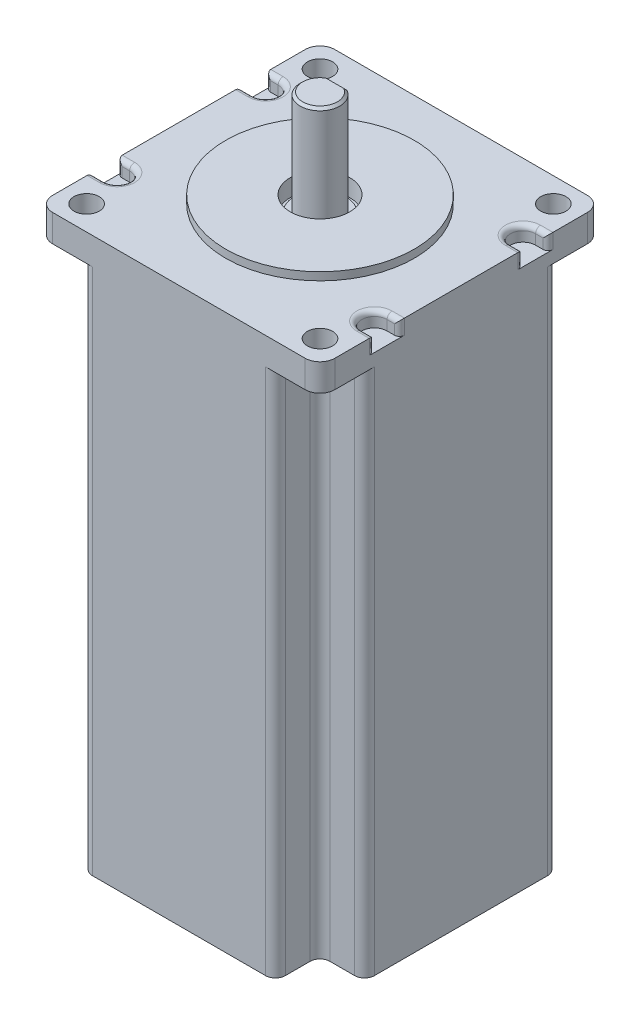
from build123d import *

# Parameters (mm, degrees)
SKETCH1_W                         = 57
SKETCH1_H                         = 57
MOTOR_RECTANGULAR_FRAME_DEPTH     = 112
MOTOR_SCREW_HOLE_LENGTHS_DEPTH    = 106.5
SKETCH3_R                         = 2.55
MOTOR_MOUNT_HOLES_DEPTH           = 114.87163826
SKETCH4_R                         = 6
REAR_BEARING_AND_SHAFT_DEPTH      = 4.5
SKETCH5_R                         = 6
SKETCH5_R_2                       = 4.5
REAR_BEARING_SHIELD_DEPTH         = 0.5
SKETCH6_R                         = 8
HOLLOWED_SECTION_REAR_DEPTH       = 3
SKETCH7_R                         = 19.05
FRONT_PLATFORM_EXTRUDE_DEPTH      = 1.6
FRONT_START                       = -3
SKETCH8_R                         = 6
FRONT_BEARING_DEPTH               = 3
FRONT_SHAFT_DEPTH                 = 21
FRONT_START_2                     = -0.5
SKETCH10_R                        = 6
SKETCH10_R_2                      = 5.25
FRONT_BEARING_SHEILD_DEPTH        = 0.5
MOTOR_SHAFT_CHAMFER_SIZE          = 0.5
MOTOR_FRONT_EDGE_FILLET_R         = 3
FRONT_COVER_SCREW_INDENTS_DEPTH   = 3
FRONT_COVER_SCREW_INDENT_FILLET_R = 1
SKETCH12_W                        = 7
SKETCH12_H                        = 5
SKETCH12_W_2                      = 5
SKETCH12_H_2                      = 4
WIRE_AREA_DEPTH                   = 3


with BuildPart() as part:
    # Sketch1 → Motor rectangular frame (new body)
    with BuildSketch(Plane(origin=(0, 0, 0), x_dir=(1, 0, 0), z_dir=(0, 1, 0))):
        Rectangle(SKETCH1_W, SKETCH1_H)
    extrude(amount=MOTOR_RECTANGULAR_FRAME_DEPTH)

    # Sketch2 → Motor screw hole lengths (cut)
    with BuildSketch(Plane.XZ):
        with BuildLine():
            Line((-26.5, 19.5), (-21.5, 19.5))
            ThreePointArc((-21.5, 19.5), (-20.085786438, 20.085786438), (-19.5, 21.5))
            Line((-19.5, 21.5), (-19.5, 26.5))
            ThreePointArc((-19.5, 26.5), (-18.914213562, 27.914213562), (-17.5, 28.5))
            Line((-17.5, 28.5), (-28.5, 28.5))
            Line((-28.5, 28.5), (-28.5, 17.5))
            ThreePointArc((-28.5, 17.5), (-27.914213562, 18.914213562), (-26.5, 19.5))
        make_face()
        with BuildLine():
            Line((19.5, 26.5), (19.5, 21.5))
            ThreePointArc((19.5, 21.5), (20.085786438, 20.085786438), (21.5, 19.5))
            Line((21.5, 19.5), (26.5, 19.5))
            ThreePointArc((26.5, 19.5), (27.914213562, 18.914213562), (28.5, 17.5))
            Line((28.5, 17.5), (28.5, 28.5))
            Line((28.5, 28.5), (17.5, 28.5))
            ThreePointArc((17.5, 28.5), (18.914213562, 27.914213562), (19.5, 26.5))
        make_face()
        with BuildLine():
            Line((26.5, -19.5), (21.5, -19.5))
            ThreePointArc((21.5, -19.5), (20.085786438, -20.085786438), (19.5, -21.5))
            Line((19.5, -21.5), (19.5, -26.5))
            ThreePointArc((19.5, -26.5), (18.914213562, -27.914213562), (17.5, -28.5))
            Line((17.5, -28.5), (28.5, -28.5))
            Line((28.5, -28.5), (28.5, -17.5))
            ThreePointArc((28.5, -17.5), (27.914213562, -18.914213562), (26.5, -19.5))
        make_face()
        with BuildLine():
            Line((-19.5, -26.5), (-19.5, -21.5))
            ThreePointArc((-19.5, -21.5), (-20.085786438, -20.085786438), (-21.5, -19.5))
            Line((-21.5, -19.5), (-26.5, -19.5))
            ThreePointArc((-26.5, -19.5), (-27.914213562, -18.914213562), (-28.5, -17.5))
            Line((-28.5, -17.5), (-28.5, -28.5))
            Line((-28.5, -28.5), (-17.5, -28.5))
            ThreePointArc((-17.5, -28.5), (-18.914213562, -27.914213562), (-19.5, -26.5))
        make_face()
    extrude(amount=-MOTOR_SCREW_HOLE_LENGTHS_DEPTH, mode=Mode.SUBTRACT)

    # Sketch3 → Motor mount holes (cut, through all)
    with BuildSketch(Plane.XZ.offset(-106.5)):
        with Locations(Location((-23.57, 23.57, 0), (0, 0, 270))):
            Circle(SKETCH3_R)
        with Locations(Location((23.57, 23.57, 0), (0, 0, 270))):
            Circle(SKETCH3_R)
        with Locations(Location((23.57, -23.57, 0), (0, 0, 90))):
            Circle(SKETCH3_R)
        with Locations(Location((-23.57, -23.57, 0), (0, 0, 90))):
            Circle(SKETCH3_R)
    extrude(amount=-MOTOR_MOUNT_HOLES_DEPTH, mode=Mode.SUBTRACT)

    # Sketch4 → Rear bearing and shaft (cut)
    with BuildSketch(Plane.XZ):
        with Locations(Location((0, 0, 0), (0, 0, 270))):
            Circle(SKETCH4_R)
    extrude(amount=-REAR_BEARING_AND_SHAFT_DEPTH, mode=Mode.SUBTRACT)

    # Sketch5 → Rear bearing shield (cut)
    with BuildSketch(Plane.XZ.offset(-4.5)):
        with Locations(Location((0, 0, 0), (0, 0, 270))):
            Circle(SKETCH5_R)
        with Locations(Location((0, 0, 0), (0, 0, 270))):
            Circle(SKETCH5_R_2, mode=Mode.SUBTRACT)
    extrude(amount=-REAR_BEARING_SHIELD_DEPTH, mode=Mode.SUBTRACT)

    # Sketch6 → Hollowed section (rear) (cut)
    with BuildSketch(Plane.XZ.offset(-4.5)):
        with Locations(Location((0, 0, 0), (0, 0, 270))):
            Circle(SKETCH6_R)
    extrude(amount=HOLLOWED_SECTION_REAR_DEPTH, mode=Mode.SUBTRACT)

    # Sketch7 → Front platform extrude (add)
    with BuildSketch(Plane(origin=(0, 112, 0), x_dir=(1, 0, 0), z_dir=(0, 1, 0))):
        with Locations(Location((0, 0, 0), (0, 0, 270))):
            Circle(SKETCH7_R)
    extrude(amount=FRONT_PLATFORM_EXTRUDE_DEPTH)

    # Sketch8 → Front bearing (cut)
    with BuildSketch(Plane(origin=(0, 113.6, 0), x_dir=(1, 0, 0), z_dir=(0, 1, 0)).offset(FRONT_START)):
        with Locations(Location((0, 0, 0), (0, 0, 90))):
            Circle(SKETCH8_R)
    extrude(amount=FRONT_BEARING_DEPTH, mode=Mode.SUBTRACT)

    # Sketch9 → Front shaft (add)
    with BuildSketch(Plane(origin=(0, 110.6, 0), x_dir=(1, 0, 0), z_dir=(0, 1, 0))):
        with BuildLine():
            Line((-1.936491673, 3.5), (1.936491673, 3.5))
            ThreePointArc((1.936491673, 3.5), (0, -4), (-1.936491673, 3.5))
        make_face()
    extrude(amount=FRONT_SHAFT_DEPTH)

    # Sketch10 → Front bearing sheild (cut)
    with BuildSketch(Plane(origin=(0, 110.6, 0), x_dir=(1, 0, 0), z_dir=(0, 1, 0)).offset(FRONT_START_2)):
        with Locations(Location((0, 0, 0), (0, 0, 90))):
            Circle(SKETCH10_R)
        with Locations(Location((0, 0, 0), (0, 0, 270))):
            Circle(SKETCH10_R_2, mode=Mode.SUBTRACT)
    extrude(amount=FRONT_BEARING_SHEILD_DEPTH, mode=Mode.SUBTRACT)

    # Motor shaft chamfer
    motor_shaft_chamfer_edges = [part.edges().sort_by_distance(p)[0] for p in [
        (0, 131.6, 4),
        (0, 131.6, -3.5),
    ]]
    chamfer(motor_shaft_chamfer_edges, length=MOTOR_SHAFT_CHAMFER_SIZE - 0.0001)  # a hair under: the kernel refuses the full size

    # Motor front edge fillet
    motor_front_edge_fillet_edges = [part.edges().sort_by_distance(p)[0] for p in [
        (28.5, 109.25, 28.5),
        (-28.5, 109.25, 28.5),
        (-28.5, 109.25, -28.5),
        (28.5, 109.25, -28.5),
    ]]
    fillet(motor_front_edge_fillet_edges, radius=MOTOR_FRONT_EDGE_FILLET_R)

    # Sketch11 → Front cover screw indents (cut)
    with BuildSketch(Plane(origin=(0, 112, 0), x_dir=(1, 0, 0), z_dir=(0, 1, 0))):
        with BuildLine():
            Line((26, 17.55), (28.5, 17.55))
            Line((28.5, 17.55), (28.5, 12.45))
            Line((28.5, 12.45), (26, 12.45))
            ThreePointArc((26, 12.45), (23.45, 15), (26, 17.55))
        make_face()
        with BuildLine():
            Line((26, -12.45), (28.5, -12.45))
            Line((28.5, -12.45), (28.5, -17.55))
            Line((28.5, -17.55), (26, -17.55))
            ThreePointArc((26, -17.55), (23.45, -15), (26, -12.45))
        make_face()
        with BuildLine():
            Line((-26, -12.45), (-28.5, -12.45))
            Line((-28.5, -12.45), (-28.5, -17.55))
            Line((-28.5, -17.55), (-26, -17.55))
            ThreePointArc((-26, -17.55), (-23.45, -15), (-26, -12.45))
        make_face()
        with BuildLine():
            Line((-26, 17.55), (-28.5, 17.55))
            Line((-28.5, 17.55), (-28.5, 12.45))
            Line((-28.5, 12.45), (-26, 12.45))
            ThreePointArc((-26, 12.45), (-23.45, 15), (-26, 17.55))
        make_face()
    extrude(amount=-FRONT_COVER_SCREW_INDENTS_DEPTH, mode=Mode.SUBTRACT)

    # Front cover screw indent fillet
    front_cover_screw_indent_fillet_edges = [part.edges().sort_by_distance(p)[0] for p in [
        (-28.5, 110.5, -12.45),
        (-28.5, 110.5, -17.55),
        (-23.45, 112, -15),
        (-27.25, 112, -17.55),
        (-27.25, 112, -12.45),
        (-28.5, 110.5, 17.55),
        (-28.5, 110.5, 12.45),
        (-23.45, 112, 15),
        (-27.25, 112, 12.45),
        (-27.25, 112, 17.55),
        (28.5, 110.5, 12.45),
        (28.5, 110.5, 17.55),
        (23.45, 112, 15),
        (27.25, 112, 17.55),
        (27.25, 112, 12.45),
        (28.5, 110.5, -17.55),
        (28.5, 110.5, -12.45),
        (23.45, 112, -15),
        (27.25, 112, -12.45),
        (27.25, 112, -17.55),
    ]]
    fillet(front_cover_screw_indent_fillet_edges, radius=FRONT_COVER_SCREW_INDENT_FILLET_R)

    # Sketch12 → Wire area (add)
    with BuildSketch(Plane(origin=(0, 0, -28.5), x_dir=(-1, 0, 0), z_dir=(0, 0, -1))):
        with Locations((0, 2.5)):
            Rectangle(SKETCH12_W, SKETCH12_H)
        with Locations((0, 2.5)):
            Rectangle(SKETCH12_W_2, SKETCH12_H_2, mode=Mode.SUBTRACT)
    extrude(amount=WIRE_AREA_DEPTH)


solid = part.part
